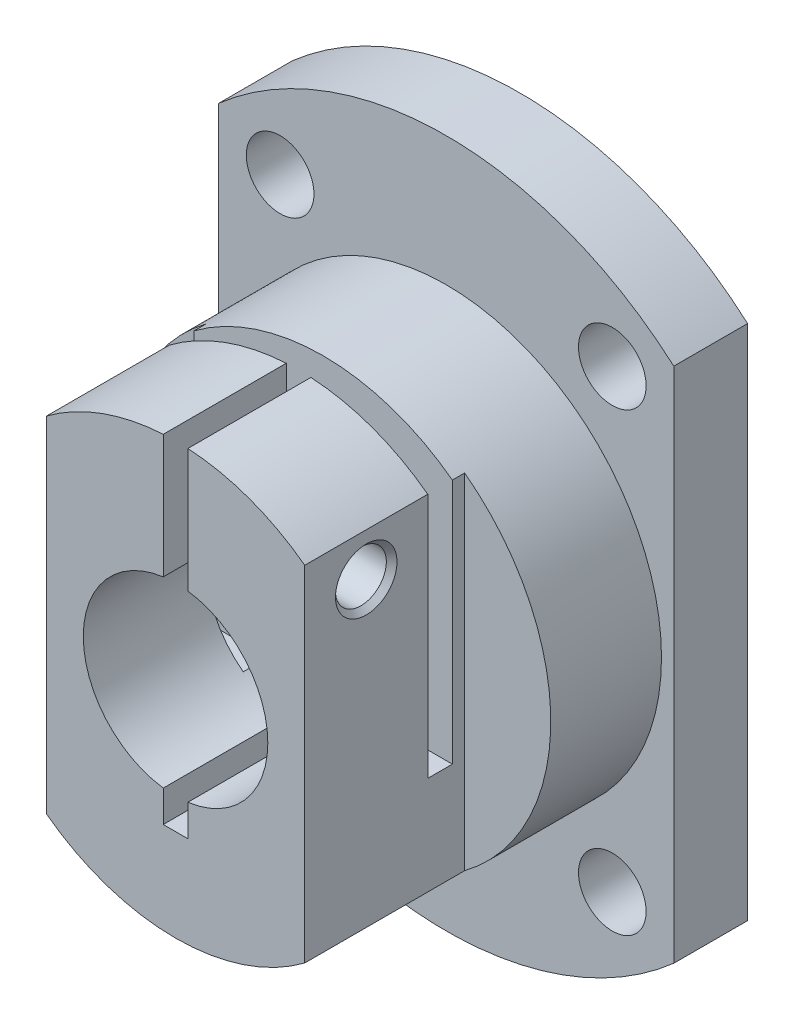
from build123d import *

# Parameters (mm, degrees)
EXTRUDE_1_DEPTH             = 14
EXTRUDE_1_DEPTH_BACK        = 14
SKETCH_1_R                  = 28
SKETCH_2_R                  = 112
SKETCH_2_R_2                = 17.5
CUT_EXTRUDE_1_DEPTH         = 22
CUT_EXTRUDE_2_DEPTH         = 28
CUT_EXTRUDE_2_DEPTH_BACK    = 28
SKETCH_3_W                  = 35
SKETCH_3_H                  = 56
CUT_EXTRUDE_3_DEPTH         = 28
CUT_EXTRUDE_3_DEPTH_BACK    = 28
SKETCH_4_W                  = 35
SKETCH_4_H                  = 56
SKETCH_5_W                  = 35
SKETCH_5_H                  = 35
CUT_EXTRUDE_4_DEPTH         = 28
SKETCH_6_W                  = 35
SKETCH_6_H                  = 35
CUT_EXTRUDE_5_DEPTH         = 28
SKETCH_7_R                  = 2.75
CUT_EXTRUDE_6_DEPTH         = 6
PATTERN_LINEAR_1_COUNT      = 2
PATTERN_LINEAR_1_PITCH      = 27
PATTERN_LINEAR_1_COUNT_DIR2 = 2
PATTERN_LINEAR_1_PITCH_DIR2 = 37
SKETCH_9_W                  = 2
SKETCH_9_H                  = 45
CUT_EXTRUDE_7_DEPTH         = 12
CUT_EXTRUDE_8_DEPTH         = 35
CUT_EXTRUDE_8_DEPTH_BACK    = 35
SKETCH_10_W                 = 2
SKETCH_10_H                 = 41


with BuildPart() as part:
    # 草图1 → 凸台-拉伸1 (new, two sides: drawn at the far end of the back side and taken through both)
    with BuildSketch(Plane.XY.offset(-EXTRUDE_1_DEPTH_BACK)):
        Circle(SKETCH_1_R)
    extrude(amount=EXTRUDE_1_DEPTH + EXTRUDE_1_DEPTH_BACK)

    # 草图2 → 切除-拉伸1 (cut)
    with BuildSketch(Plane.XY.offset(-8)):
        Circle(SKETCH_2_R)
        Circle(SKETCH_2_R_2, mode=Mode.SUBTRACT)
    extrude(amount=CUT_EXTRUDE_1_DEPTH, mode=Mode.SUBTRACT)

    # 草图3 → 切除-拉伸2 (cut, two sides: drawn at the far end of the back side and taken through both)
    with BuildSketch(Plane.XY.offset(-CUT_EXTRUDE_2_DEPTH_BACK)):
        with Locations((36, 0)):
            Rectangle(SKETCH_3_W, SKETCH_3_H)
    extrude(amount=CUT_EXTRUDE_2_DEPTH + CUT_EXTRUDE_2_DEPTH_BACK, mode=Mode.SUBTRACT)

    # 草图4 → 切除-拉伸3 (cut, two sides: drawn at the far end of the back side and taken through both)
    with BuildSketch(Plane.XY.offset(-CUT_EXTRUDE_3_DEPTH_BACK)):
        with Locations((-36, 0)):
            Rectangle(SKETCH_4_W, SKETCH_4_H)
    extrude(amount=CUT_EXTRUDE_3_DEPTH + CUT_EXTRUDE_3_DEPTH_BACK, mode=Mode.SUBTRACT)

    # 草图5 → 切除-拉伸4 (cut)
    with BuildSketch(Plane.XY.offset(1)):
        with Locations((28, 0)):
            Rectangle(SKETCH_5_W, SKETCH_5_H)
    extrude(amount=CUT_EXTRUDE_4_DEPTH, mode=Mode.SUBTRACT)

    # 草图6 → 切除-拉伸5 (cut)
    with BuildSketch(Plane.XY.offset(1)):
        with Locations((-28, 0)):
            Rectangle(SKETCH_6_W, SKETCH_6_H)
    extrude(amount=CUT_EXTRUDE_5_DEPTH, mode=Mode.SUBTRACT)

    # 草图7 → 切除-拉伸6 (cut)
    with BuildSketch(Plane.XY.offset(-8)):
        with Locations((-13.5, -18.5)):
            Circle(SKETCH_7_R)
    cut_extrude_6 = extrude(amount=-CUT_EXTRUDE_6_DEPTH, mode=Mode.SUBTRACT)

    # 阵列(线性)1: Cut-Extrude 6 2 × 2
    with Locations(*[(i * PATTERN_LINEAR_1_PITCH, j * PATTERN_LINEAR_1_PITCH_DIR2, 0) for i in range(PATTERN_LINEAR_1_COUNT) for j in range(PATTERN_LINEAR_1_COUNT_DIR2) if (i, j) != (0, 0)]):
        add(cut_extrude_6, mode=Mode.SUBTRACT)

    # 草图9 → 切除-拉伸7 (cut)
    with BuildSketch(Plane.XY.offset(14)):
        with Locations((0, 12.5)):
            Rectangle(SKETCH_9_W, SKETCH_9_H)
    extrude(amount=-CUT_EXTRUDE_7_DEPTH, mode=Mode.SUBTRACT)

    # 草图10 → 切除-拉伸8 (cut, two sides: drawn at the far end of the back side and taken through both)
    with BuildSketch(Plane(origin=(0, 0, 0), x_dir=(0, 0, -1), z_dir=(1, 0, 0)).offset(-CUT_EXTRUDE_8_DEPTH_BACK)):
        with Locations((-3, 14.5)):
            Rectangle(SKETCH_10_W, SKETCH_10_H)
    extrude(amount=CUT_EXTRUDE_8_DEPTH + CUT_EXTRUDE_8_DEPTH_BACK, mode=Mode.SUBTRACT)

    # 草图11 → 切除-旋转1 (revolve, cut)
    with BuildSketch(Plane.XY.offset(9)):
        Polygon((-10.5, 10.5), (-10.5, 13), (-10.067, 12.567), (-1, 12.567), (-1, 10.5), align=None)
    revolve(axis=Axis((-1, 10.5, 9), (-1, 0, 0)), mode=Mode.SUBTRACT)

    # 草图12 → 切除-旋转2 (revolve, cut)
    with BuildSketch(Plane.XY.offset(9)):
        Polygon((1, 10.5), (1, 12.567), (10.067, 12.567), (10.5, 13), (10.5, 10.5), align=None)
    revolve(axis=Axis((10.5, 10.5, 9), (-1, 0, 0)), mode=Mode.SUBTRACT)

    # 草图13 → 切除-旋转3 (revolve, cut)
    with BuildSketch(Plane(origin=(0, 0, 0), x_dir=(0, 0, -1), z_dir=(1, 0, 0))):
        Polygon((-14, 0), (-14, 7.5), (5, 7.5), (5, 14), (12, 14), (12, 15.05), (13.2, 15.05), (13.2, 14), (14, 14), (14, 0), align=None)
    revolve(axis=Axis((0, 0, -14), (0, 0, 1)), mode=Mode.SUBTRACT)


solid = part.part
